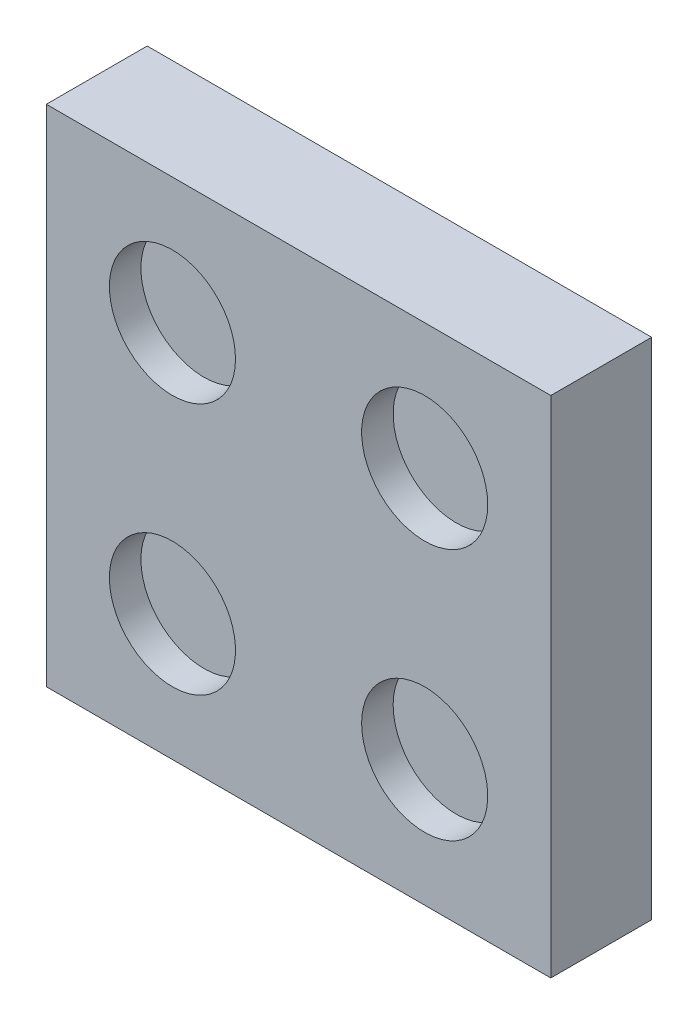
from build123d import *

# Parameters (mm, degrees)
SKETCH1_W           = 50.8
SKETCH1_H           = 50.8
BOSS_EXTRUDE1_DEPTH = 10.16
SKETCH3_R           = 6.35
SKETCH3_R_2         = 2.54
CUT_EXTRUDE2_DEPTH  = 3.175
SKETCH6_R           = 12.7
CUT_EXTRUDE3_DEPTH  = 5.08
SKETCH8_W           = 2.54
SKETCH8_H           = 12.753282951
CUT_EXTRUDE6_DEPTH  = 5.08


with BuildPart() as part:
    # Sketch1 → Boss-Extrude1 (new body)
    with BuildSketch(Plane.XY):
        with Locations((25.4, 25.4)):
            Rectangle(SKETCH1_W, SKETCH1_H)
    extrude(amount=BOSS_EXTRUDE1_DEPTH)

    # Sketch3 → Cut-Extrude2 (cut)
    with BuildSketch(Plane.XY.offset(10.16)):
        with Locations((12.7, 139.7)):
            Circle(SKETCH3_R)
        with Locations((38.1, 139.7)):
            Circle(SKETCH3_R)
        with Locations((63.5, 139.7)):
            Circle(SKETCH3_R_2)
        with Locations((88.9, 139.7)):
            Circle(SKETCH3_R_2)
        with Locations((88.9, 114.3)):
            Circle(SKETCH3_R_2)
        with Locations((63.5, 114.3)):
            Circle(SKETCH3_R_2)
        with Locations((38.1, 114.3)):
            Circle(SKETCH3_R)
        with Locations((12.7, 114.3)):
            Circle(SKETCH3_R)
        with Locations((88.9, 88.9)):
            Circle(SKETCH3_R_2)
        with Locations((63.5, 88.9)):
            Circle(SKETCH3_R_2)
        with Locations((38.1, 88.9)):
            Circle(SKETCH3_R)
        with Locations((12.7, 88.9)):
            Circle(SKETCH3_R)
        with Locations((88.9, 63.5)):
            Circle(SKETCH3_R_2)
        with Locations((63.5, 63.5)):
            Circle(SKETCH3_R_2)
        with Locations((38.1, 63.5)):
            Circle(SKETCH3_R)
        with Locations((12.7, 63.5)):
            Circle(SKETCH3_R)
        with Locations((88.9, 38.1)):
            Circle(SKETCH3_R_2)
        with Locations((63.5, 38.1)):
            Circle(SKETCH3_R_2)
        with Locations((38.1, 38.1)):
            Circle(SKETCH3_R)
        with Locations((12.7, 38.1)):
            Circle(SKETCH3_R)
        with Locations((88.9, 12.7)):
            Circle(SKETCH3_R_2)
        with Locations((63.5, 12.7)):
            Circle(SKETCH3_R_2)
        with Locations((38.1, 12.7)):
            Circle(SKETCH3_R)
        with Locations((12.7, 12.7)):
            Circle(SKETCH3_R)
    extrude(amount=-CUT_EXTRUDE2_DEPTH, mode=Mode.SUBTRACT)

    # Sketch6 → Cut-Extrude3 (cut)
    with BuildSketch(Plane(origin=(0, 0, 0), x_dir=(-1, 0, 0), z_dir=(0, 0, -1))):
        with Locations((-25.4, 25.4)):
            Circle(SKETCH6_R)
    extrude(amount=-CUT_EXTRUDE3_DEPTH, mode=Mode.SUBTRACT)

    # Sketch8 → Cut-Extrude6 (cut)
    with BuildSketch(Plane(origin=(0, 0, 0), x_dir=(-1, 0, 0), z_dir=(0, 0, -1))):
        with Locations((-25.292130756, 6.376641476)):
            Rectangle(SKETCH8_W, SKETCH8_H)
    extrude(amount=-CUT_EXTRUDE6_DEPTH, mode=Mode.SUBTRACT)


solid = part.part
